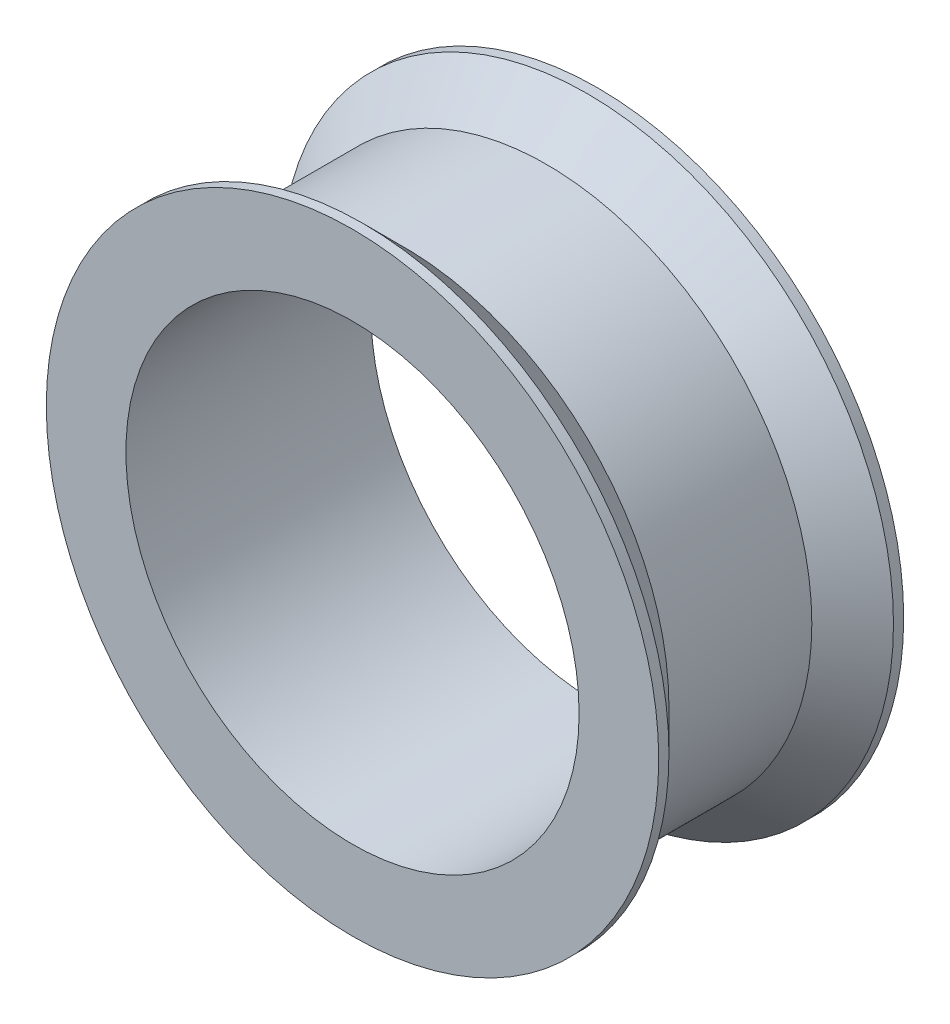
from build123d import *

# Parameters (mm, degrees)
SKETCH1_R           = 15
SKETCH1_R_2         = 13
SKETCH1_R_3         = 11.1
BOSS_EXTRUDE1_DEPTH = 6
SKETCH1_3_R         = 15
SKETCH1_3_R_2       = 13
CUT_EXTRUDE1_DEPTH  = 3.5
CHAMFER1_SIZE       = 2


with BuildPart() as part:
    # Sketch1 → Boss-Extrude1 (new, symmetric)
    # profile 1 of 2: a face of its own
    with BuildSketch(Plane.XY):
        Circle(SKETCH1_R)
        Circle(SKETCH1_R_2, mode=Mode.SUBTRACT)
    # profile 2 of 2: a face of its own
    with BuildSketch(Plane.XY):
        Circle(SKETCH1_R_2)
        Circle(SKETCH1_R_3, mode=Mode.SUBTRACT)
    extrude(amount=BOSS_EXTRUDE1_DEPTH, both=True)

    # Sketch1<3> → Cut-Extrude1 (cut, symmetric)
    with BuildSketch(Plane.XY):
        Circle(SKETCH1_3_R)
        Circle(SKETCH1_3_R_2, mode=Mode.SUBTRACT)
    extrude(amount=CUT_EXTRUDE1_DEPTH, both=True, mode=Mode.SUBTRACT)

    # Chamfer1
    chamfer1_edges = [part.edges().sort_by_distance(p)[0] for p in [
        (-15, 0, -3.5),
        (-15, 0, 3.5),
    ]]
    chamfer(chamfer1_edges, length=CHAMFER1_SIZE - 0.0001)  # a hair under: the kernel refuses the full size


solid = part.part
